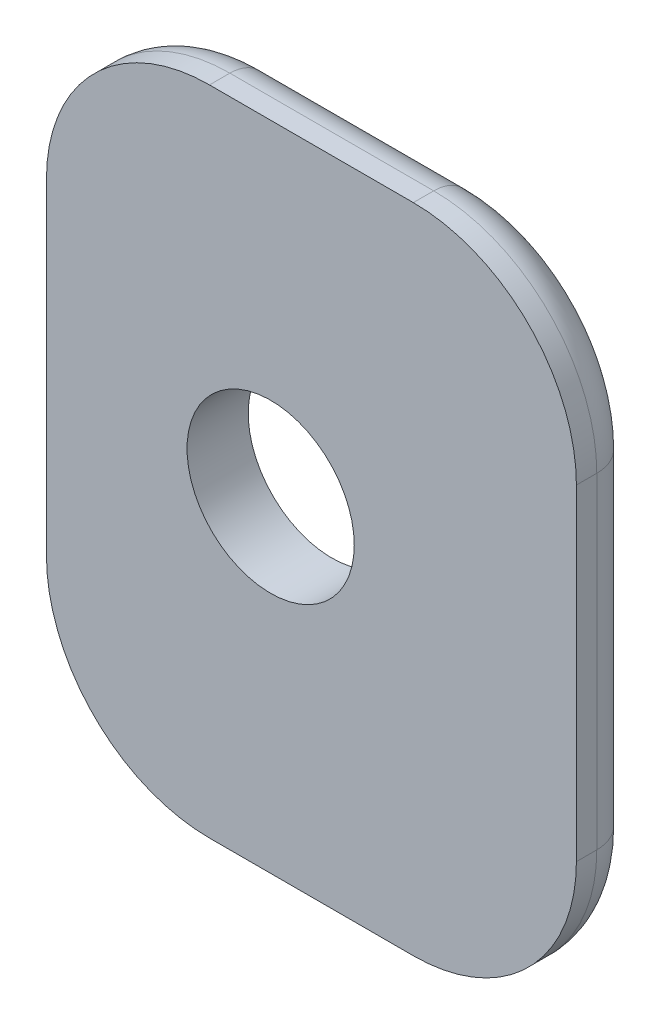
from build123d import *

# Parameters (mm, degrees)
SKETCH1_W           = 26
SKETCH1_H           = 32
SKETCH1_R           = 4.1021
BOSS_EXTRUDE1_DEPTH = 3
FILLET1_R           = 8
FILLET2_R           = 2


with BuildPart() as part:
    # Sketch1 → Boss-Extrude1 (new body)
    with BuildSketch(Plane.XY):
        with Locations((2, 0)):
            Rectangle(SKETCH1_W, SKETCH1_H)
        Circle(SKETCH1_R, mode=Mode.SUBTRACT)
    extrude(amount=BOSS_EXTRUDE1_DEPTH)

    # Fillet1
    fillet1_edges = [part.edges().sort_by_distance(p)[0] for p in [
        (15, -16, 1.5),
        (-11, -16, 1.5),
        (15, 16, 1.5),
        (-11, 16, 1.5),
    ]]
    fillet(fillet1_edges, radius=FILLET1_R)

    # Fillet2
    fillet2_edges = [part.edges().sort_by_distance(p)[0] for p in [
        (-8.656854249, 13.656854249, 0),
        (2, 16, 0),
        (12.656854249, 13.656854249, 0),
        (15, 0, 0),
        (12.656854249, -13.656854249, 0),
        (2, -16, 0),
        (-8.656854249, -13.656854249, 0),
        (-11, 0, 0),
    ]]
    fillet(fillet2_edges, radius=FILLET2_R)


solid = part.part
